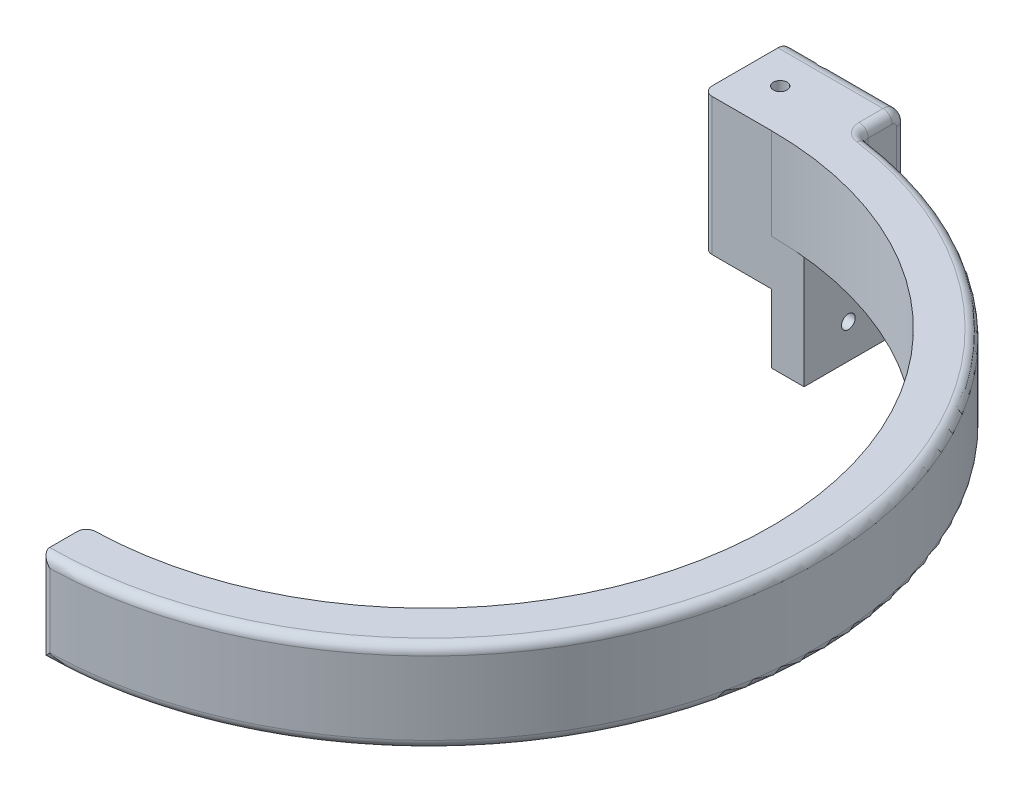
from build123d import *

# Parameters (mm, degrees)
BOSS_EXTRUDE1_DEPTH = 20
SKETCH3_W           = 19.409715081
SKETCH3_H           = 30
BOSS_EXTRUDE3_DEPTH = 15
FILLET1_R           = 2
SKETCH4_R           = 1.5
CUT_EXTRUDE1_DEPTH  = 131.530434453
FILLET2_R           = 3
SKETCH7_W           = 7.118887736
SKETCH7_H           = 19.409715081
BOSS_EXTRUDE5_DEPTH = 25
CUT_EXTRUDE3_REACH  = 126.915
SKETCH9_R           = 1.5


with BuildPart() as part:
    # Sketch1 → Boss-Extrude1 (new body)
    with BuildSketch(Plane(origin=(0, 0, 0), x_dir=(1, 0, 0), z_dir=(0, 1, 0))):
        with BuildLine():
            Line((0, -75), (0, -85))
            ThreePointArc((0, -85), (84.852300446, -5.008703332), (10, 84.409715081))
            Line((10, 84.409715081), (10, 94.409715081))
            Line((10, 94.409715081), (0, 94.409715081))
            Line((0, 94.409715081), (0, 75))
            ThreePointArc((0, 75), (75, 0), (0, -75))
        make_face()
    extrude(amount=BOSS_EXTRUDE1_DEPTH)

    # Sketch3 → Boss-Extrude3 (add)
    with BuildSketch(Plane.ZY):
        with Locations((-84.704857541, 5)):
            Rectangle(SKETCH3_W, SKETCH3_H)
    extrude(amount=BOSS_EXTRUDE3_DEPTH)

    # Fillet1
    fillet1_edges = [part.edges().sort_by_distance(p)[0] for p in [
        (84.852300446, 20, 5.008703332),
        (10, 10, -94.409715081),
        (10, 10, -84.409715081),
        (0, 10, 85),
        (0, 10, 75),
        (10, 20, -89.409715081),
        (-15, 5, -94.409715081),
        (-15, 5, -75),
        (10, 0, -89.409715081),
        (84.852300446, 0, 5.008703332),
    ]]
    fillet(fillet1_edges, radius=FILLET1_R)

    # Sketch4 → Cut-Extrude1 (cut, through all)
    with BuildSketch(Plane(origin=(0, 20, 0), x_dir=(1, 0, 0), z_dir=(0, 1, 0))):
        with Locations(Location((-7.5, 84.409715081, 0), (0, 0, 270))):
            Circle(SKETCH4_R)
        with Locations((-7.5, 94.409715081)):
            Circle(SKETCH4_R)
    extrude(amount=-CUT_EXTRUDE1_DEPTH, mode=Mode.SUBTRACT)

    # Fillet2
    # the kernel refuses this fillet: 3 mm, written as the material it takes off along each edge
    with BuildSketch(Plane(origin=(10, 17, -91.409715081), x_dir=(0, 0, -1), z_dir=(0, -1, 0))) as fillet2_piece_1:
        with BuildLine():
            CenterArc((1, -2), 2, 0, 90)
            Line((3, -2), (3, 0))
            Line((3, 0), (1, 0))
        make_face()
    revolve(axis=Axis((10, 17, -91.409715081), (1, 0, 0)), revolution_arc=90, mode=Mode.SUBTRACT)
    with BuildSketch(Plane(origin=(-20.5, 20, -94.409715081), x_dir=(0, 0, 1), z_dir=(1, 0, 0))) as fillet2_piece_2:
        with BuildLine():
            CenterArc((FILLET2_R, FILLET2_R), FILLET2_R, 180, 90)
            Line((0, FILLET2_R), (0, 0))
            Line((0, 0), (FILLET2_R, 0))
        make_face()
    extrude(amount=19, mode=Mode.SUBTRACT)
    with BuildSketch(Plane(origin=(-13.5, 20, -94.409715081), x_dir=(0, -1, 0), z_dir=(1, 0, 0))) as fillet2_piece_3:
        with BuildLine():
            CenterArc((FILLET2_R, -FILLET2_R), FILLET2_R, 90, 90)
            Line((0, -FILLET2_R), (0, 0))
            Line((0, 0), (FILLET2_R, 0))
        make_face()
    extrude(amount=23.5, mode=Mode.SUBTRACT)

    # Sketch7 → Boss-Extrude5 (add)
    with BuildSketch(Plane(origin=(0, 0, 0), x_dir=(-1, 0, 0), z_dir=(0, -1, 0))):
        with Locations((-3.559443868, 84.704857541)):
            Rectangle(SKETCH7_W, SKETCH7_H)
    extrude(amount=BOSS_EXTRUDE5_DEPTH)

    # Sketch9 → Cut-Extrude3 (cut, up to next)
    with BuildSketch(Plane(origin=(7.118887736, 0, 0), x_dir=(0, 0, -1), z_dir=(1, 0, 0)), mode=Mode.PRIVATE) as cut_extrude3_sk1:
        with Locations((84.70485754, -17.5)):
            Circle(SKETCH9_R)
    cut_extrude3_tool1 = extrude(cut_extrude3_sk1.sketch, amount=-CUT_EXTRUDE3_REACH, mode=Mode.PRIVATE) & part.part
    add(cut_extrude3_tool1.solids().sort_by_distance((7.118888, -17.5, -84.704858))[0], mode=Mode.SUBTRACT)


solid = part.part
